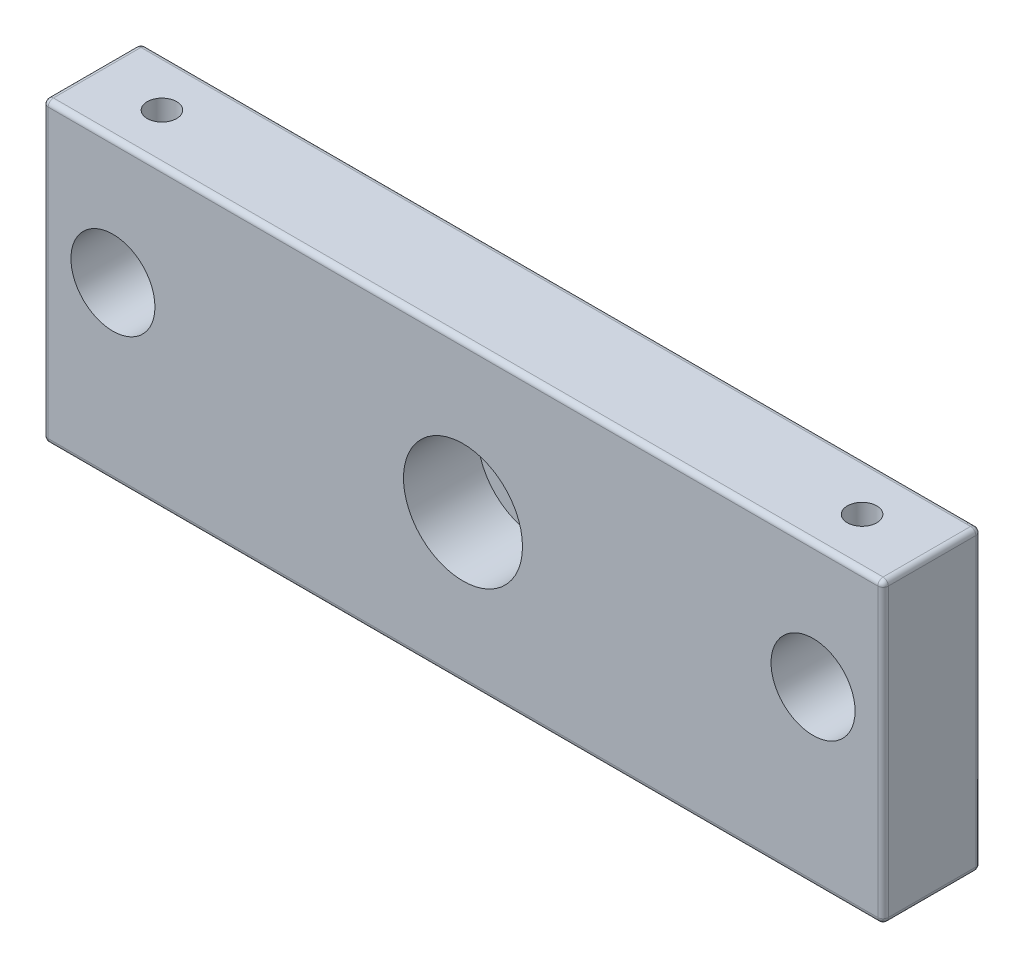
from build123d import *

# Parameters (mm, degrees)
SKETCH1_W           = 120
SKETCH1_H           = 42.5
BOSS_EXTRUDE1_DEPTH = 7
SKETCH2_R           = 8.5
CUT_EXTRUDE1_DEPTH  = 10.6
SKETCH3_R           = 4
CUT_EXTRUDE2_DEPTH  = 65.528462712
SKETCH5_R           = 6
CUT_EXTRUDE4_DEPTH  = 66.173326599
SKETCH6_R           = 2.1
SKETCH6_R_2         = 1.25
CUT_EXTRUDE5_DEPTH  = 10
FILLET1_R           = 0.75
CUT_EXTRUDE6_REACH  = 75.86
SKETCH7_R           = 2.1


with BuildPart() as part:
    # Sketch1 → Boss-Extrude1 (new, symmetric)
    with BuildSketch(Plane.XY):
        Rectangle(SKETCH1_W, SKETCH1_H)
    extrude(amount=BOSS_EXTRUDE1_DEPTH, both=True)

    # Sketch2 → Cut-Extrude1 (cut)
    with BuildSketch(Plane.XY.offset(7)):
        Circle(SKETCH2_R)
    extrude(amount=-CUT_EXTRUDE1_DEPTH, mode=Mode.SUBTRACT)

    # Sketch3 → Cut-Extrude2 (cut, through all)
    with BuildSketch(Plane.XY.offset(-3.6)):
        Circle(SKETCH3_R)
    extrude(amount=-CUT_EXTRUDE2_DEPTH, mode=Mode.SUBTRACT)

    # Sketch5 → Cut-Extrude4 (cut, through all)
    with BuildSketch(Plane.XY.offset(7)):
        with Locations((-50, 3.4)):
            Circle(SKETCH5_R)
        with Locations((50, 3.4)):
            Circle(SKETCH5_R)
    extrude(amount=-CUT_EXTRUDE4_DEPTH, mode=Mode.SUBTRACT)

    # Sketch6 → Cut-Extrude5 (cut)
    with BuildSketch(Plane.XZ.offset(21.25)):
        with Locations((-50, 0)):
            Circle(SKETCH6_R)
        with Locations((-25, 0)):
            Circle(SKETCH6_R)
        with Locations((25, 0)):
            Circle(SKETCH6_R)
        with Locations((50, 0)):
            Circle(SKETCH6_R)
        with Locations((-37.5, 0)):
            Circle(SKETCH6_R_2)
        with Locations((37.5, 0)):
            Circle(SKETCH6_R_2)
    extrude(amount=-CUT_EXTRUDE5_DEPTH, mode=Mode.SUBTRACT)

    # Fillet1
    fillet1_edges = [part.edges().sort_by_distance(p)[0] for p in [
        (60, 21.25, 0),
        (60, 0, -7),
        (0, 21.25, -7),
        (60, 0, 7),
        (60, -21.25, 0),
        (0, -21.25, -7),
        (0, 21.25, 7),
        (-60, 21.25, 0),
        (-60, 0, -7),
        (0, -21.25, 7),
        (-60, -21.25, 0),
        (-60, 0, 7),
    ]]
    fillet(fillet1_edges, radius=FILLET1_R)

    # Sketch7 → Cut-Extrude6 (cut, up to next)
    with BuildSketch(Plane(origin=(0, 21.25, 0), x_dir=(1, 0, 0), z_dir=(0, 1, 0)), mode=Mode.PRIVATE) as cut_extrude6_sk1:
        with Locations((-50, 0)):
            Circle(SKETCH7_R)
    cut_extrude6_tool1 = extrude(cut_extrude6_sk1.sketch, amount=-CUT_EXTRUDE6_REACH, mode=Mode.PRIVATE) & part.part
    # Sketch7 → Cut-Extrude6 (cut, up to next)
    with BuildSketch(Plane(origin=(0, 21.25, 0), x_dir=(1, 0, 0), z_dir=(0, 1, 0)), mode=Mode.PRIVATE) as cut_extrude6_sk2:
        with Locations((50, 0)):
            Circle(SKETCH7_R)
    cut_extrude6_tool2 = extrude(cut_extrude6_sk2.sketch, amount=-CUT_EXTRUDE6_REACH, mode=Mode.PRIVATE) & part.part
    add(cut_extrude6_tool1.solids().sort_by_distance((-50, 21.25, 0))[0], mode=Mode.SUBTRACT)
    add(cut_extrude6_tool2.solids().sort_by_distance((50, 21.25, 0))[0], mode=Mode.SUBTRACT)


solid = part.part
